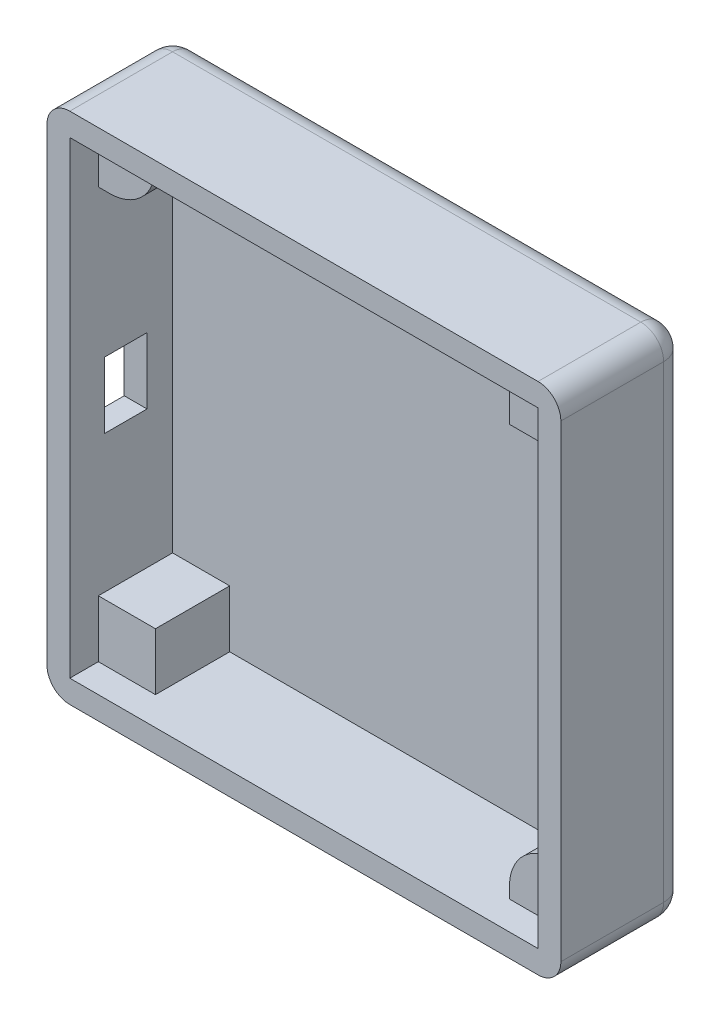
from build123d import *

# Parameters (mm, degrees)
SCHIZZO2_W                   = 45
SCHIZZO2_H                   = 45
ESTRUSIONE_ESTRUSIONE2_DEPTH = 11
SVUOTA1_T                    = -2
RACCORDO1_R                  = 2
RACCORDO2_R                  = 2
SCHIZZO3_W                   = 5
SCHIZZO3_H                   = 5
ESTRUSIONE_ESTRUSIONE3_DEPTH = 6.5
SCHIZZO4_W                   = 5
SCHIZZO4_H                   = 5
ESTRUSIONE_ESTRUSIONE4_DEPTH = 6.5
RACCORDO3_R                  = 4
SCHIZZO5_W                   = 5
SCHIZZO5_H                   = 5
ESTRUSIONE_ESTRUSIONE5_DEPTH = 6.5
SCHIZZO7_W                   = 3.721232587
SCHIZZO7_H                   = 5.791483481
TAGLIO_ESTRUSIONE1_DEPTH     = 3


with BuildPart() as part:
    # Schizzo2 → Estrusione-Estrusione2 (new body)
    with BuildSketch(Plane.XY):
        with Locations((22.5, 22.5)):
            Rectangle(SCHIZZO2_W, SCHIZZO2_H)
    extrude(amount=ESTRUSIONE_ESTRUSIONE2_DEPTH)

    # Svuota1
    svuota1_openings = [part.faces().sort_by_distance(p)[0] for p in [
        (22.5, 22.5, 11),
    ]]
    offset(amount=SVUOTA1_T, openings=svuota1_openings, kind=Kind.INTERSECTION)

    # Raccordo1
    raccordo1_edges = [part.edges().sort_by_distance(p)[0] for p in [
        (45, 45, 5.5),
        (45, 0, 5.5),
        (0, 0, 5.5),
        (0, 45, 5.5),
    ]]
    fillet(raccordo1_edges, radius=RACCORDO1_R)

    # Raccordo2
    raccordo2_edges = [part.edges().sort_by_distance(p)[0] for p in [
        (44.414213562, 0.585786438, 0),
        (22.5, 0, 0),
        (0.585786438, 0.585786438, 0),
        (0, 22.5, 0),
        (0.585786438, 44.414213562, 0),
        (22.5, 45, 0),
        (44.414213562, 44.414213562, 0),
        (45, 22.5, 0),
    ]]
    fillet(raccordo2_edges, radius=RACCORDO2_R)

    # Schizzo3 → Estrusione-Estrusione3 (add)
    with BuildSketch(Plane.XY.offset(2)):
        with Locations((4.5, 40.5)):
            Rectangle(SCHIZZO3_W, SCHIZZO3_H)
    extrude(amount=ESTRUSIONE_ESTRUSIONE3_DEPTH)

    # Schizzo4 → Estrusione-Estrusione4 (add)
    with BuildSketch(Plane.XY.offset(2)):
        with Locations((40.5, 4.5)):
            Rectangle(SCHIZZO4_W, SCHIZZO4_H)
    extrude(amount=ESTRUSIONE_ESTRUSIONE4_DEPTH)

    # Raccordo3
    raccordo3_edges = [part.edges().sort_by_distance(p)[0] for p in [
        (38, 7, 5.25),
        (7, 38, 5.25),
    ]]
    fillet(raccordo3_edges, radius=RACCORDO3_R)

    # Schizzo5 → Estrusione-Estrusione5 (add)
    with BuildSketch(Plane.XY.offset(2)):
        with Locations((40.5, 40.5)):
            Rectangle(SCHIZZO5_W, SCHIZZO5_H)
        with Locations((4.5, 4.5)):
            Rectangle(SCHIZZO5_W, SCHIZZO5_H)
    extrude(amount=ESTRUSIONE_ESTRUSIONE5_DEPTH)

    # Schizzo7 → Taglio-Estrusione1 (cut)
    with BuildSketch(Plane.ZY):
        with Locations((6.095303288, 21.928649717)):
            Rectangle(SCHIZZO7_W, SCHIZZO7_H)
    extrude(amount=-TAGLIO_ESTRUSIONE1_DEPTH, mode=Mode.SUBTRACT)


solid = part.part
